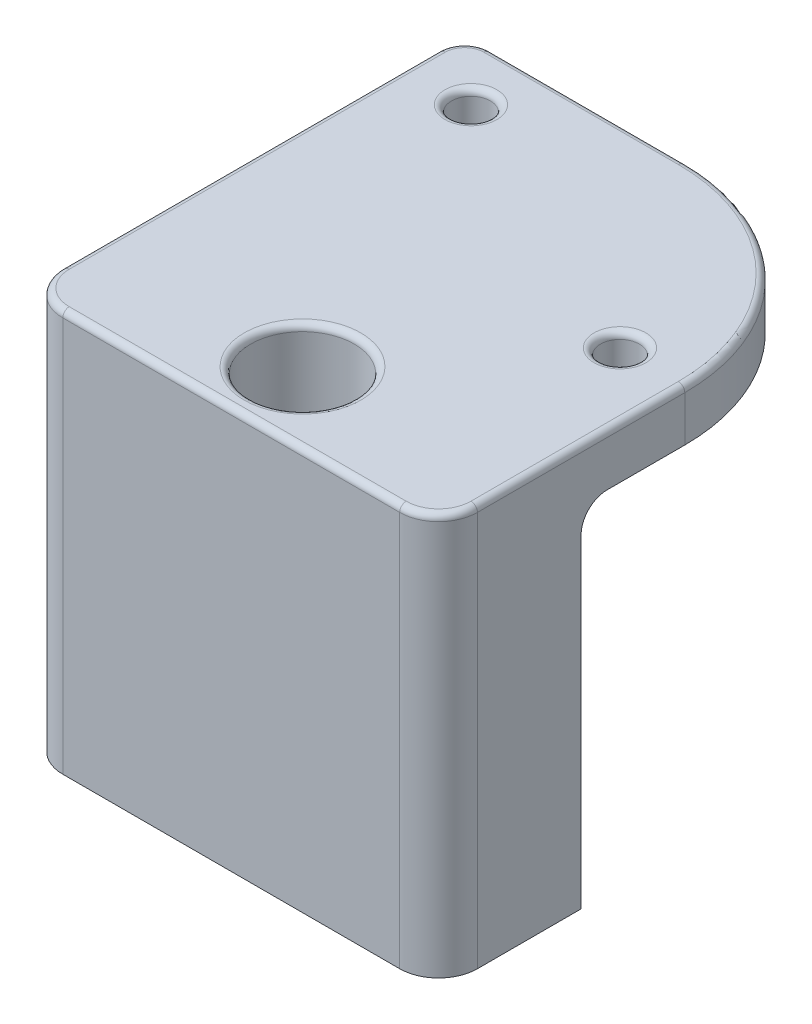
from build123d import *

# Parameters (mm, degrees)
SKETCH_1_W          = 32
SKETCH_1_H          = 11
SKETCH_1_R          = 1.6
EXTRUDE_1_DEPTH     = 27
SKETCH_2_R          = 1.5
EXTRUDE_2_DEPTH     = 4
FILLET_3_R          = 3
FILLET_4_R          = 3
CUT_EXTRUDE_START   = 10
SKETCH_3_R          = 4
CUT_EXTRUDE_1_DEPTH = 15
FILLET_5_R          = 2
EXTRUDE_START       = 9.5
SKETCH_4_R          = 3
SKETCH_4_R_2        = 1.5
EXTRUDE_3_DEPTH     = 9.5
FILLET_6_R          = 2
FILLET_7_R          = 0.5


with BuildPart() as part:
    # Эскиз1 → Бобышка-Вытянуть1 (new body)
    with BuildSketch(Plane(origin=(0, 0, 0), x_dir=(1, 0, 0), z_dir=(0, 1, 0))):
        with Locations((16, 5.5)):
            Rectangle(SKETCH_1_W, SKETCH_1_H)
        with Locations((16, 5.5)):
            Circle(SKETCH_1_R, mode=Mode.SUBTRACT)
    extrude(amount=EXTRUDE_1_DEPTH)

    # Эскиз2 → Бобышка-Вытянуть2 (add)
    with BuildSketch(Plane(origin=(0, 27, 0), x_dir=(1, 0, 0), z_dir=(0, 1, 0))):
        with BuildLine():
            Line((0, 0), (0, 34))
            Line((0, 34), (17, 34))
            ThreePointArc((17, 34), (27.606601718, 29.606601718), (32, 19))
            Line((32, 19), (32, 0))
            Line((32, 0), (0, 0))
        make_face()
        with Locations((5, 29.5)):
            Circle(SKETCH_2_R, mode=Mode.SUBTRACT)
        with Locations((27, 19)):
            Circle(SKETCH_2_R, mode=Mode.SUBTRACT)
    extrude(amount=EXTRUDE_2_DEPTH)

    # Скругление3
    fillet_3_edges = [part.edges().sort_by_distance(p)[0] for p in [
        (32, 15.5, 0),
    ]]
    fillet(fillet_3_edges, radius=FILLET_3_R)

    # Скругление4
    fillet_4_edges = [part.edges().sort_by_distance(p)[0] for p in [
        (0, 15.5, 0),
    ]]
    fillet(fillet_4_edges, radius=FILLET_4_R)

    # Эскиз3 → Вырез-Вытянуть1 (cut)
    with BuildSketch(Plane.XZ.offset(-27).offset(CUT_EXTRUDE_START)):
        with Locations((16, -5.5)):
            Circle(SKETCH_3_R)
    extrude(amount=-CUT_EXTRUDE_1_DEPTH, mode=Mode.SUBTRACT)

    # Скругление5
    fillet_5_edges = [part.edges().sort_by_distance(p)[0] for p in [
        (16, 27, -11),
    ]]
    fillet(fillet_5_edges, radius=FILLET_5_R)

    # Эскиз4 → Бобышка-Вытянуть3 (add)
    with BuildSketch(Plane.XZ.offset(-27).offset(EXTRUDE_START)):
        with Locations((5, -29.5)):
            Circle(SKETCH_4_R)
        with Locations((5, -29.5)):
            Circle(SKETCH_4_R_2, mode=Mode.SUBTRACT)
    extrude(amount=-EXTRUDE_3_DEPTH)

    # Скругление6
    fillet_6_edges = [part.edges().sort_by_distance(p)[0] for p in [
        (0, 29, -34),
    ]]
    fillet(fillet_6_edges, radius=FILLET_6_R)

    # Скругление7
    fillet_7_edges = [part.edges().sort_by_distance(p)[0] for p in [
        (25.5, 31, -19),
        (27.606601718, 31, -29.606601718),
        (32, 31, -11),
        (0, 31, -17.5),
        (0.585786438, 31, -33.414213562),
        (9.5, 31, -34),
        (3.5, 31, -29.5),
        (31.121320344, 31, -0.878679656),
        (16, 31, 0),
        (0.878679656, 31, -0.878679656),
        (12, 31, -5.5),
    ]]
    fillet(fillet_7_edges, radius=FILLET_7_R)


solid = part.part
